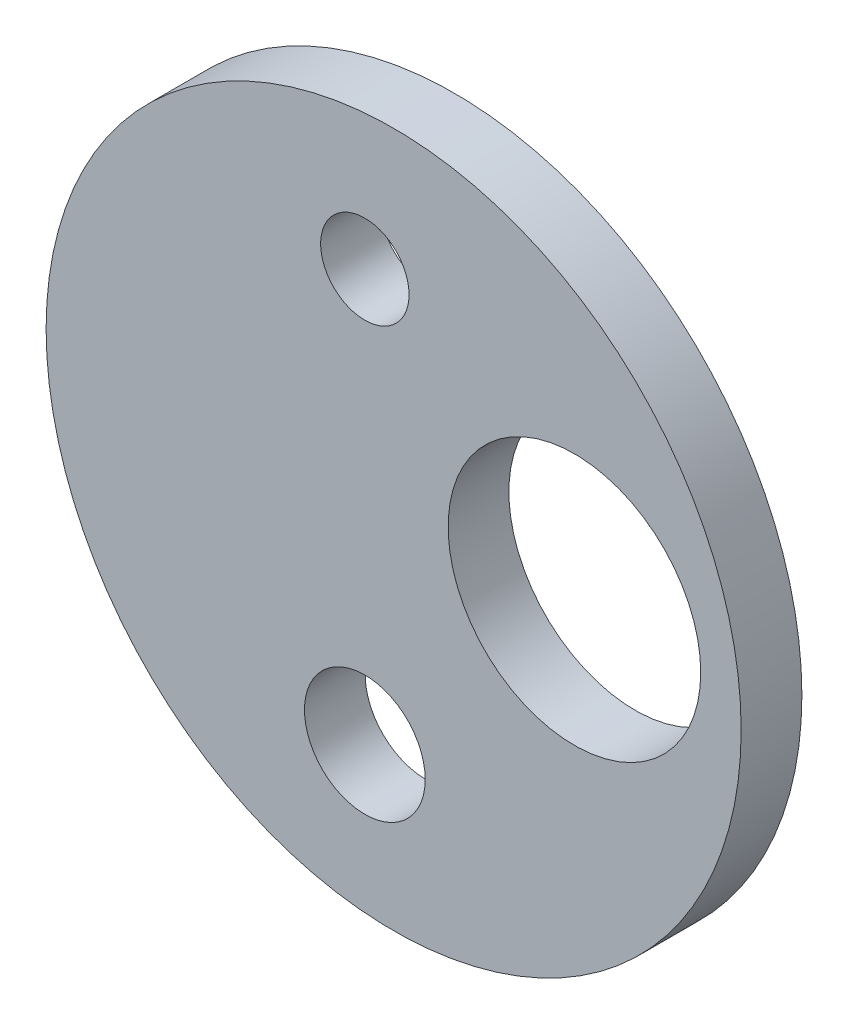
from build123d import *

# Parameters (mm, degrees)
CROQUIS1_R              = 57.226702921
CROQUIS1_R_2            = 7.277968804
CROQUIS1_R_3            = 9.940183118
CROQUIS1_R_4            = 20.796607535
SALIENTE_EXTRUIR1_DEPTH = 10


with BuildPart() as part:
    # Croquis1 → Saliente-Extruir1 (new body)
    with BuildSketch(Plane.XY):
        Circle(CROQUIS1_R)
        with Locations((-4.741989664, 34.759410431)):
            Circle(CROQUIS1_R_2, mode=Mode.SUBTRACT)
        with Locations((-4.741989664, -33.045918367)):
            Circle(CROQUIS1_R_3, mode=Mode.SUBTRACT)
        with Locations((29.772636186, 4.89569161)):
            Circle(CROQUIS1_R_4, mode=Mode.SUBTRACT)
    extrude(amount=SALIENTE_EXTRUIR1_DEPTH)


solid = part.part
